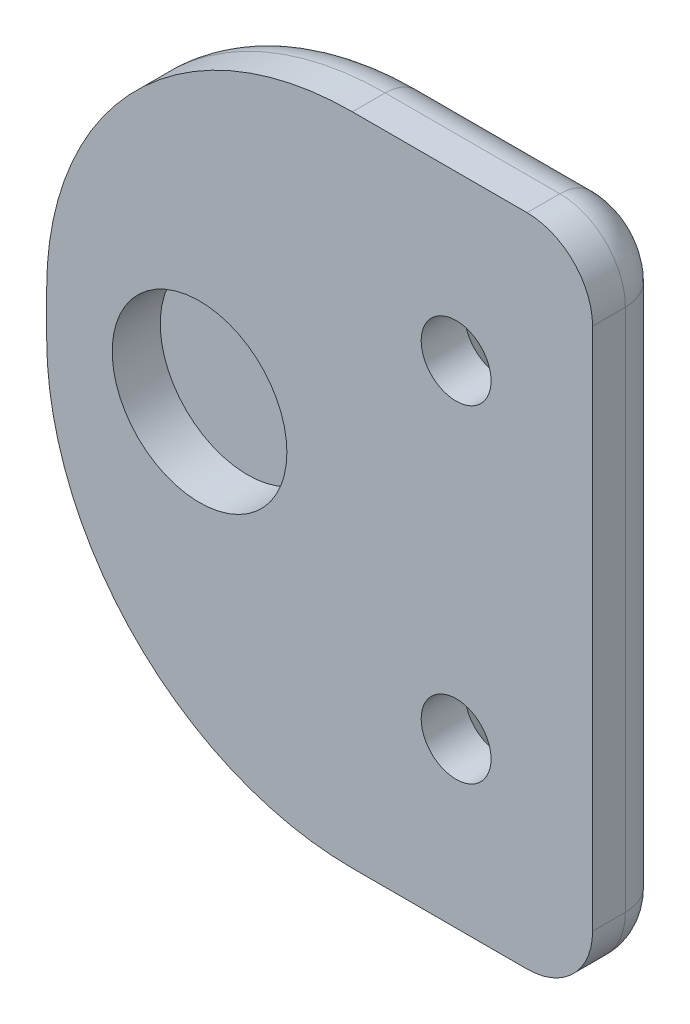
from build123d import *

# Parameters (mm, degrees)
SKETCH_1_R          = 1.6
EXTRUDE_1_DEPTH     = 3.5
SKETCH_2_R          = 4
CUT_EXTRUDE_1_DEPTH = 2.2
FILLET_1_R          = 2
CHAMFER_1_SIZE      = 1.5


with BuildPart() as part:
    # Эскиз1 → Бобышка-Вытянуть1 (new body)
    with BuildSketch(Plane.XY):
        with BuildLine():
            Line((1.5, 15), (9.5, 15))
            ThreePointArc((9.5, 15), (11.621320344, 14.121320344), (12.5, 12))
            Line((12.5, 12), (12.5, -12))
            ThreePointArc((12.5, -12), (11.621320344, -14.121320344), (9.5, -15))
            Line((9.5, -15), (1.5, -15))
            ThreePointArc((1.5, -15), (-8.399494937, -10.899494937), (-12.5, -1))
            Line((-12.5, -1), (-12.5, 1))
            ThreePointArc((-12.5, 1), (-8.399494937, 10.899494937), (1.5, 15))
        make_face()
        with Locations((6.25, 7.5)):
            Circle(SKETCH_1_R, mode=Mode.SUBTRACT)
        with Locations((6.25, -7.5)):
            Circle(SKETCH_1_R, mode=Mode.SUBTRACT)
    extrude(amount=EXTRUDE_1_DEPTH)

    # Эскиз2 → Вырез-Вытянуть1 (cut)
    with BuildSketch(Plane.XY.offset(3.5)):
        with Locations((-5.5, 0)):
            Circle(SKETCH_2_R)
    extrude(amount=-CUT_EXTRUDE_1_DEPTH, mode=Mode.SUBTRACT)

    # Скругление1
    fillet_1_edges = [part.edges().sort_by_distance(p)[0] for p in [
        (11.621320344, -14.121320344, 0),
        (5.5, -15, 0),
        (-8.399494937, -10.899494937, 0),
        (-12.5, 0, 0),
        (-8.399494937, 10.899494937, 0),
        (5.5, 15, 0),
        (11.621320344, 14.121320344, 0),
        (12.5, 0, 0),
    ]]
    fillet(fillet_1_edges, radius=FILLET_1_R)

    # Фаска1
    chamfer_1_edges = [part.edges().sort_by_distance(p)[0] for p in [
        (4.65, -7.5, 0),
        (4.65, 7.5, 0),
    ]]
    chamfer(chamfer_1_edges, length=CHAMFER_1_SIZE)


solid = part.part
